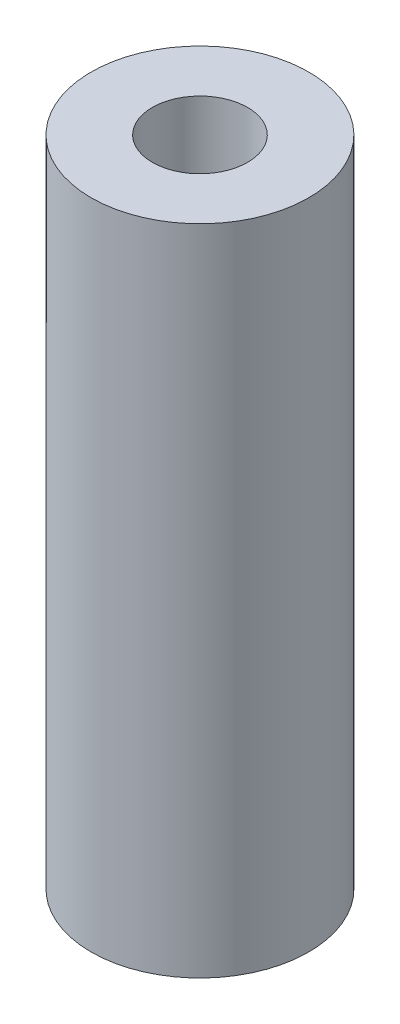
from build123d import *

# Parameters (mm, degrees)
SKETCH2_R           = 2
BOSS_EXTRUDE1_DEPTH = 12
SKETCH3_R           = 0.875
CUT_EXTRUDE1_DEPTH  = 13.328828006


with BuildPart() as part:
    # Sketch2 → Boss-Extrude1 (new body)
    with BuildSketch(Plane(origin=(0, 0, 0), x_dir=(1, 0, 0), z_dir=(0, 1, 0))):
        Circle(SKETCH2_R)
    extrude(amount=BOSS_EXTRUDE1_DEPTH)

    # Sketch3 → Cut-Extrude1 (cut, through all)
    with BuildSketch(Plane(origin=(0, 12, 0), x_dir=(1, 0, 0), z_dir=(0, 1, 0))):
        Circle(SKETCH3_R)
    extrude(amount=-CUT_EXTRUDE1_DEPTH, mode=Mode.SUBTRACT)


solid = part.part
